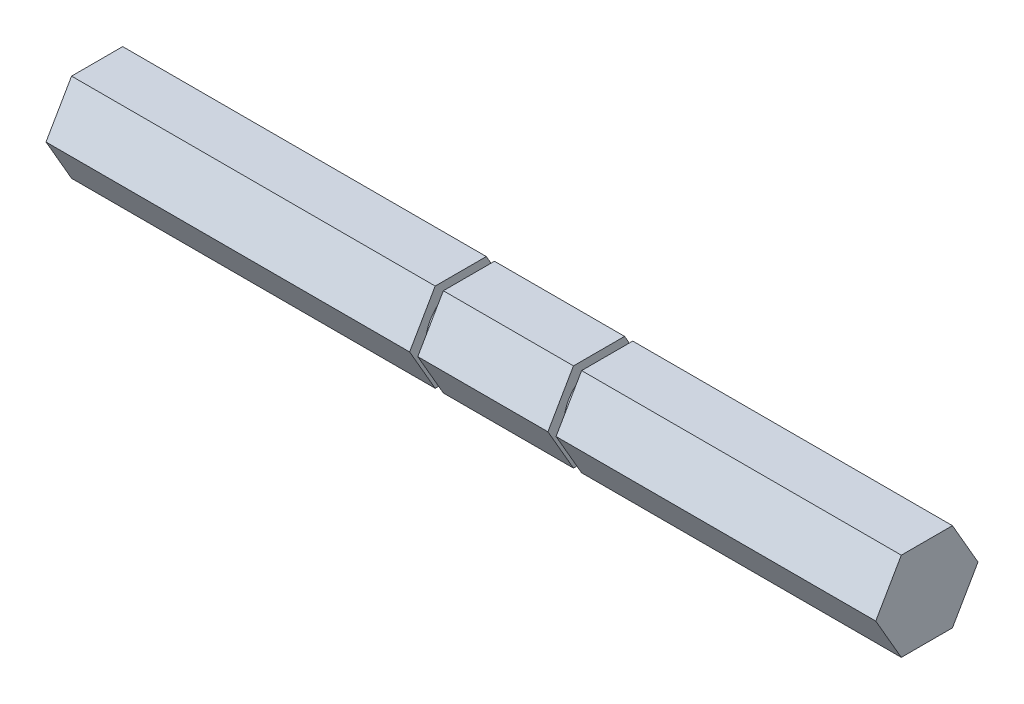
from build123d import *

# Parameters (mm, degrees)
BOSS_EXTRUDE1_DEPTH = 59.5
SKETCH5_W           = 1.1684
SKETCH5_H           = 8.939323218


with BuildPart() as part:
    # Sketch2 → Boss-Extrude1 (new, symmetric)
    with BuildSketch(Plane(origin=(0, 0, 0), x_dir=(0, 0, -1), z_dir=(1, 0, 0))):
        Polygon((7.332348419, 0), (3.666174209, 6.35), (-3.666174209, 6.35), (-7.332348419, 0), (-3.666174209, -6.35), (3.666174209, -6.35), align=None)
    extrude(amount=BOSS_EXTRUDE1_DEPTH, both=True)

    # Sketch5 → Cut-Revolve1 (revolve, cut)
    with BuildSketch(Plane.XY):
        with Locations((13.0658, 9.498861609)):
            Rectangle(SKETCH5_W, SKETCH5_H)
        with Locations((-6.7658, 9.498861609)):
            Rectangle(SKETCH5_W, SKETCH5_H)
    revolve(axis=Axis((0, 0, 0), (1, 0, 0)), mode=Mode.SUBTRACT)


solid = part.part
